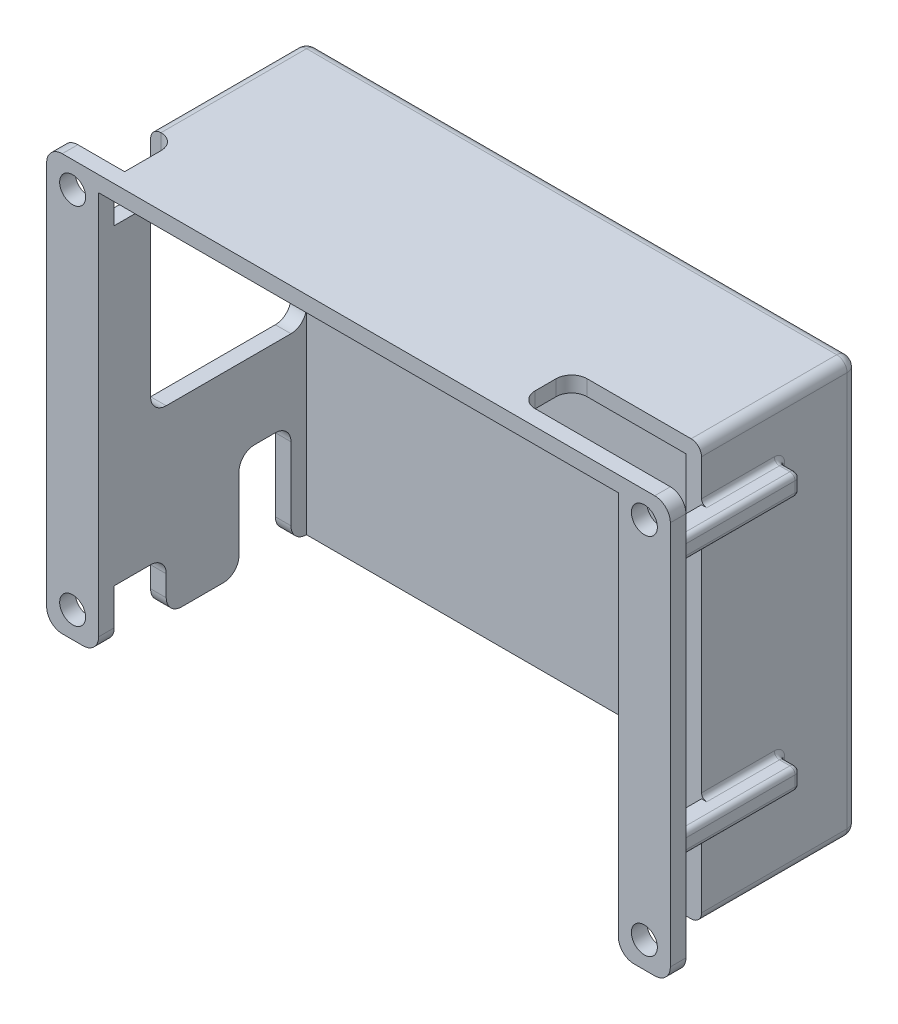
from build123d import *

# Parameters (mm, degrees)
SKETCH2_W           = 60
SKETCH2_H           = 40
SKETCH2_R           = 1.25
BOSS_EXTRUDE3_DEPTH = 1.5
SKETCH3_W           = 53
SKETCH3_H           = 40
BOSS_EXTRUDE4_DEPTH = 20
SKETCH7_W           = 50
SKETCH7_H           = 38.5
CUT_EXTRUDE4_DEPTH  = 20
SKETCH8_W           = 5
SKETCH8_H           = 40
CUT_EXTRUDE5_DEPTH  = 12.5
SKETCH11_W          = 5
SKETCH11_H          = 5
CUT_EXTRUDE8_DEPTH  = 2.5
SKETCH17_W          = 15
SKETCH17_H          = 17.5
SKETCH17_W_2        = 5
SKETCH17_H_2        = 10
CUT_EXTRUDE13_DEPTH = 2.5
SKETCH19_W          = 2
SKETCH19_H          = 2
BOSS_EXTRUDE5_DEPTH = 12.5
FILLET1_R           = 1.5
FILLET2_R           = 1.5
FILLET3_R           = 1
FILLET4_R           = 0.5
FILLET5_R           = 1.5


with BuildPart() as part:
    # Sketch2 → Boss-Extrude3 (new body)
    with BuildSketch(Plane.XY):
        with Locations((45.305986755, 42.83362131)):
            Rectangle(SKETCH2_W, SKETCH2_H)
        with Locations((17.805986755, 60.33362131)):
            Circle(SKETCH2_R, mode=Mode.SUBTRACT)
        with Locations((17.805986755, 25.33362131)):
            Circle(SKETCH2_R, mode=Mode.SUBTRACT)
        with Locations((72.805986755, 25.33362131)):
            Circle(SKETCH2_R, mode=Mode.SUBTRACT)
        with Locations((72.805986755, 60.33362131)):
            Circle(SKETCH2_R, mode=Mode.SUBTRACT)
    extrude(amount=BOSS_EXTRUDE3_DEPTH)

    # Sketch3 → Boss-Extrude4 (add)
    with BuildSketch(Plane(origin=(0, 0, 0), x_dir=(-1, 0, 0), z_dir=(0, 0, -1))):
        with Locations((-45.305986755, 42.83362131)):
            Rectangle(SKETCH3_W, SKETCH3_H)
    extrude(amount=BOSS_EXTRUDE4_DEPTH)

    # Sketch7 → Cut-Extrude4 (cut)
    with BuildSketch(Plane.XY.offset(1.5)):
        with Locations((45.305986755, 42.08362131)):
            Rectangle(SKETCH7_W, SKETCH7_H)
    extrude(amount=-CUT_EXTRUDE4_DEPTH, mode=Mode.SUBTRACT)

    # Sketch8 → Cut-Extrude5 (cut)
    with BuildSketch(Plane(origin=(71.805986755, 0, 0), x_dir=(0, 0, -1), z_dir=(1, 0, 0))):
        with Locations((2.5, 42.83362131)):
            Rectangle(SKETCH8_W, SKETCH8_H)
    extrude(amount=-CUT_EXTRUDE5_DEPTH, mode=Mode.SUBTRACT)

    # Sketch11 → Cut-Extrude8 (cut)
    with BuildSketch(Plane.ZY.offset(-18.805986755)):
        with Locations((-2.5, 60.33362131)):
            Rectangle(SKETCH11_W, SKETCH11_H)
        with Locations((-2.5, 25.33362131)):
            Rectangle(SKETCH11_W, SKETCH11_H)
    extrude(amount=-CUT_EXTRUDE8_DEPTH, mode=Mode.SUBTRACT)

    # Sketch17 → Cut-Extrude13 (cut)
    with BuildSketch(Plane.ZY.offset(-18.805986755)):
        with Locations((-11, 49.08362131)):
            Rectangle(SKETCH17_W, SKETCH17_H)
        with Locations((-14.5, 27.83362131)):
            Rectangle(SKETCH17_W_2, SKETCH17_H_2)
    extrude(amount=-CUT_EXTRUDE13_DEPTH, mode=Mode.SUBTRACT)

    # Sketch19 → Boss-Extrude5 (add)
    with BuildSketch(Plane(origin=(0, 0, 0), x_dir=(-1, 0, 0), z_dir=(0, 0, -1))):
        with Locations((-72.805986755, 32.33362131)):
            Rectangle(SKETCH19_W, SKETCH19_H)
        with Locations((-72.805986755, 56.83362131)):
            Rectangle(SKETCH19_W, SKETCH19_H)
    extrude(amount=BOSS_EXTRUDE5_DEPTH)

    # Fillet1
    fillet1_edges = [part.edges().sort_by_distance(p)[0] for p in [
        (70.305986755, 22.83362131, 0.75),
        (15.305986755, 62.83362131, 0.75),
        (75.305986755, 62.83362131, 0.75),
        (75.305986755, 22.83362131, 0.75),
        (15.305986755, 22.83362131, 0.75),
        (20.305986755, 22.83362131, 0.75),
    ]]
    fillet(fillet1_edges, radius=FILLET1_R)

    # Fillet2
    fillet2_edges = [part.edges().sort_by_distance(p)[0] for p in [
        (19.555986755, 57.83362131, -5),
        (19.555986755, 22.83362131, -5),
        (19.555986755, 27.83362131, -5),
        (19.555986755, 40.33362131, -18.5),
        (19.555986755, 40.33362131, -3.5),
        (19.555986755, 57.83362131, -3.5),
        (19.555986755, 57.83362131, -18.5),
        (19.555986755, 22.83362131, -17),
        (19.555986755, 32.83362131, -17),
        (19.555986755, 32.83362131, -12),
        (19.555986755, 22.83362131, -12),
        (59.305986755, 62.08362131, 0),
        (59.305986755, 62.08362131, -5),
    ]]
    fillet(fillet2_edges, radius=FILLET2_R)

    # Fillet3
    fillet3_edges = [part.edges().sort_by_distance(p)[0] for p in [
        (71.805986755, 62.83362131, -12.5),
        (71.805986755, 22.83362131, -12.5),
        (18.805986755, 62.83362131, -12.5),
        (71.805986755, 42.83362131, -20),
        (45.305986755, 22.83362131, -20),
        (18.805986755, 42.83362131, -20),
        (45.305986755, 62.83362131, -20),
    ]]
    fillet(fillet3_edges, radius=FILLET3_R)

    # Fillet4
    fillet4_edges = [part.edges().sort_by_distance(p)[0] for p in [
        (72.805986755, 55.83362131, 0),
        (72.805986755, 33.33362131, 0),
        (72.805986755, 31.33362131, 0),
        (73.805986755, 56.83362131, 0),
        (71.805986755, 32.33362131, 0),
        (73.805986755, 32.33362131, 0),
        (71.805986755, 56.83362131, 0),
        (72.805986755, 57.83362131, 0),
        (71.805986755, 32.33362131, -12.5),
        (71.805986755, 56.83362131, -12.5),
        (71.805986755, 33.33362131, -8.75),
        (71.805986755, 57.83362131, -8.75),
        (71.805986755, 55.83362131, -8.75),
        (73.805986755, 57.83362131, -6.25),
        (73.805986755, 33.33362131, -6.25),
        (71.805986755, 31.33362131, -8.75),
        (73.805986755, 31.33362131, -6.25),
        (73.805986755, 55.83362131, -6.25),
        (72.805986755, 55.83362131, -12.5),
        (73.805986755, 56.83362131, -12.5),
        (72.805986755, 57.83362131, -12.5),
        (72.805986755, 31.33362131, -12.5),
        (73.805986755, 32.33362131, -12.5),
        (72.805986755, 33.33362131, -12.5),
    ]]
    fillet(fillet4_edges, radius=FILLET4_R)

    # Fillet5
    # the kernel refuses this fillet: 1.5 mm, written as the material it adds along each edge
    with BuildSketch(Plane(origin=(21.305986755, 62.83362131, -5), x_dir=(-1, 0, 0), z_dir=(0, -1, 0))) as fillet5_piece_1:
        with BuildLine():
            CenterArc((FILLET5_R, -FILLET5_R), FILLET5_R, 90, 90)
            Line((0, -FILLET5_R), (0, 0))
            Line((0, 0), (FILLET5_R, 0))
        make_face()
    extrude(amount=1.5)


solid = part.part
